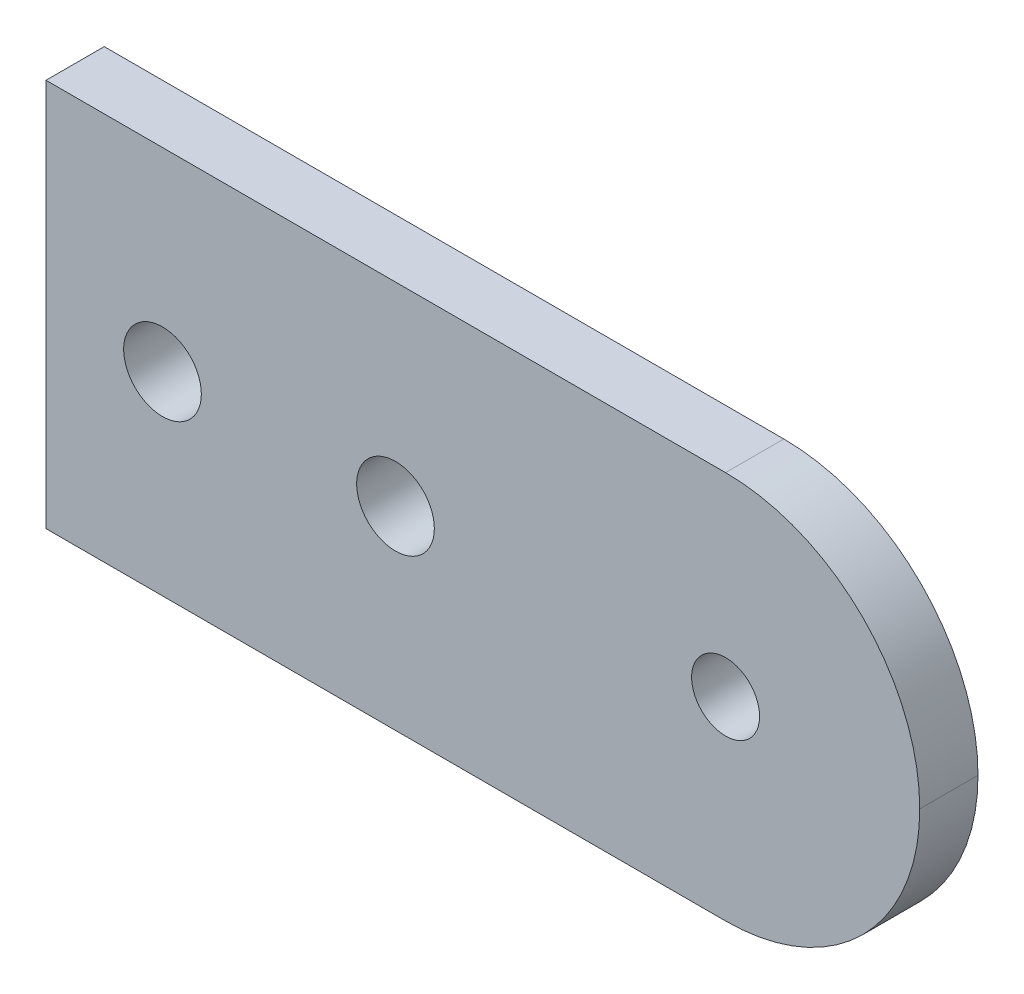
from build123d import *

# Parameters (mm, degrees)
ESBO_O1_W                = 45
ESBO_O1_H                = 20
ESBO_O1_R                = 2
ESBO_O1_R_2              = 1.75
RESSALTO_EXTRUS_O1_DEPTH = 3
FILETE1_R                = 10


with BuildPart() as part:
    # Esboço1 → Ressalto-extrusão1 (new body)
    with BuildSketch(Plane.XY):
        Rectangle(ESBO_O1_W, ESBO_O1_H)
        with Locations((-16.5, 0)):
            Circle(ESBO_O1_R, mode=Mode.SUBTRACT)
        with Locations((-4.5, 0)):
            Circle(ESBO_O1_R, mode=Mode.SUBTRACT)
        with Locations((12.5, 0)):
            Circle(ESBO_O1_R_2, mode=Mode.SUBTRACT)
    extrude(amount=RESSALTO_EXTRUS_O1_DEPTH)

    # Filete1
    filete1_edges = [part.edges().sort_by_distance(p)[0] for p in [
        (22.5, -10, 1.5),
        (22.5, 10, 1.5),
    ]]
    fillet(filete1_edges, radius=FILETE1_R - 0.0001)  # a hair under: the kernel refuses the full size


solid = part.part
